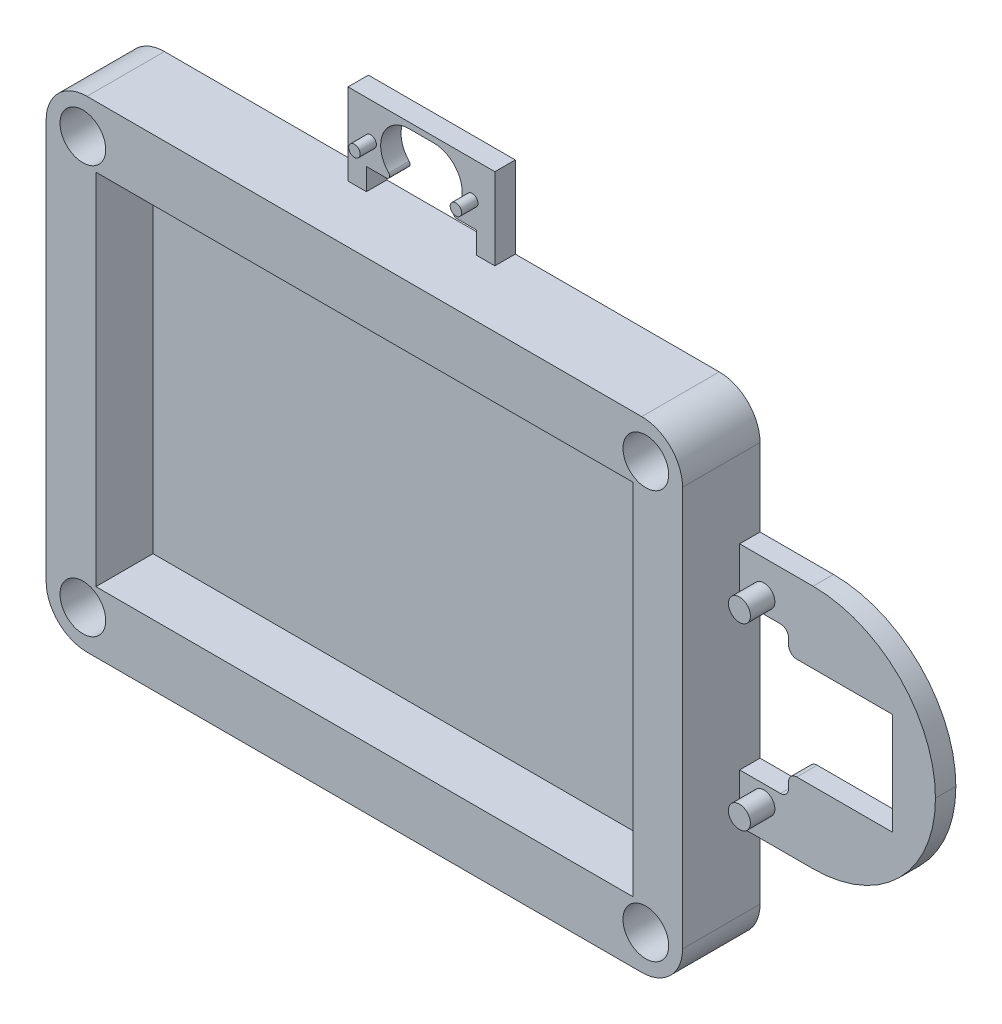
from build123d import *

# Parameters (mm, degrees)
SKETCH1_W               = 55.88
SKETCH1_H               = 83.566
BOSS_EXTRUDE1_DEPTH     = 3.175
SKETCH2_W               = 74.93
SKETCH2_H               = 102.616
SKETCH2_W_2             = 55.88
SKETCH2_H_2             = 83.566
BOSS_EXTRUDE2_DEPTH     = 12.065
CUT_EXTRUDE1_DEPTH      = 65.666075449
CUT_EXTRUDE1_DEPTH_BACK = 65.666075449
SKETCH3_R               = 3.556
CUT_EXTRUDE2_DEPTH      = 65.666075449
CUT_EXTRUDE2_DEPTH_BACK = 65.666075449
SKETCH4_W               = 1.778
SKETCH4_H               = 74.93
FILLET1_R               = 6.35
FILLET2_R               = 0.508
SKETCH5_W               = 38.1
SKETCH5_H               = 3.175
BOSS_EXTRUDE3_DEPTH     = 30.48
CUT_EXTRUDE3_DEPTH      = 89.793346738
CUT_EXTRUDE3_DEPTH_BACK = 89.793346738
SKETCH6_W               = 7.62
SKETCH6_H               = 22.86
SKETCH7_R               = 1.7145
BOSS_EXTRUDE4_DEPTH     = 3.81
CUT_EXTRUDE4_DEPTH      = 89.793346738
CUT_EXTRUDE4_DEPTH_BACK = 89.793346738
SKETCH8_W               = 22.86
SKETCH8_H               = 15.875
SKETCH9_W               = 6.6929
SKETCH9_H               = 15.875
BOSS_EXTRUDE5_DEPTH     = 3.175
FILLET3_R               = 19.05
FILLET5_R               = 1.27
SKETCH14_W              = 22.86
SKETCH14_H              = 3.175
BOSS_EXTRUDE8_DEPTH     = 12.7
CUT_EXTRUDE7_DEPTH      = 95.853357479
CUT_EXTRUDE7_DEPTH_BACK = 95.853357479
CUT_EXTRUDE8_DEPTH      = 95.853357479
CUT_EXTRUDE8_DEPTH_BACK = 95.853357479
SKETCH16_W              = 17.130818864
SKETCH16_H              = 3.4036
FILLET8_R               = 0.508
SKETCH17_R              = 0.889
BOSS_EXTRUDE9_DEPTH     = 2.54


with BuildPart() as part:
    # Sketch1 → Boss-Extrude1 (new body)
    with BuildSketch(Plane(origin=(0, 0, 0), x_dir=(0, 1, 0), z_dir=(0, 0, 1))):
        Rectangle(SKETCH1_W, SKETCH1_H)
    extrude(amount=BOSS_EXTRUDE1_DEPTH)

    # Sketch2 → Boss-Extrude2 (add)
    with BuildSketch(Plane(origin=(0, 0, 0), x_dir=(0, 1, 0), z_dir=(0, 0, 1))):
        Rectangle(SKETCH2_W, SKETCH2_H)
        Rectangle(SKETCH2_W_2, SKETCH2_H_2, mode=Mode.SUBTRACT)
    extrude(amount=BOSS_EXTRUDE2_DEPTH)

    # Sketch3 → Cut-Extrude1 (cut, two sides: drawn at the far end of the back side and taken through both)
    with BuildSketch(Plane.XY.offset(12.065).offset(-CUT_EXTRUDE1_DEPTH_BACK)):
        with Locations((-43.815, 31.75)):
            Circle(SKETCH3_R)
        with Locations((43.815, 31.75)):
            Circle(SKETCH3_R)
        with Locations((43.815, -31.75)):
            Circle(SKETCH3_R)
        with Locations((-43.815, -31.75)):
            Circle(SKETCH3_R)
    extrude(amount=CUT_EXTRUDE1_DEPTH + CUT_EXTRUDE1_DEPTH_BACK, mode=Mode.SUBTRACT)

    # Sketch4 → Cut-Extrude2 (cut, two sides: drawn at the far end of the back side and taken through both)
    with BuildSketch(Plane.XY.offset(12.065).offset(-CUT_EXTRUDE2_DEPTH_BACK)):
        with Locations((-50.419, 0)):
            Rectangle(SKETCH4_W, SKETCH4_H)
        with Locations((50.419, 0)):
            Rectangle(SKETCH4_W, SKETCH4_H)
    extrude(amount=CUT_EXTRUDE2_DEPTH + CUT_EXTRUDE2_DEPTH_BACK, mode=Mode.SUBTRACT)

    # Fillet1
    fillet1_edges = [part.edges().sort_by_distance(p)[0] for p in [
        (-49.53, -37.465, 6.0325),
        (-49.53, 37.465, 6.0325),
        (49.53, 37.465, 6.0325),
        (49.53, -37.465, 6.0325),
    ]]
    fillet(fillet1_edges, radius=FILLET1_R)

    # Fillet2
    fillet2_edges = [part.edges().sort_by_distance(p)[0] for p in [
        (-47.371, -31.75, 0),
        (40.259, -31.75, 0),
        (40.259, 31.75, 0),
        (-47.371, 31.75, 0),
    ]]
    fillet(fillet2_edges, radius=FILLET2_R)

    # Sketch5 → Boss-Extrude3 (add)
    with BuildSketch(Plane.YZ.offset(49.53)):
        with Locations((0, 1.5875)):
            Rectangle(SKETCH5_W, SKETCH5_H)
    extrude(amount=BOSS_EXTRUDE3_DEPTH)

    # Sketch6 → Cut-Extrude3 (cut, two sides: drawn at the far end of the back side and taken through both)
    with BuildSketch(Plane.XY.offset(3.175).offset(-CUT_EXTRUDE3_DEPTH_BACK)):
        with Locations((53.34, 0)):
            Rectangle(SKETCH6_W, SKETCH6_H)
    extrude(amount=CUT_EXTRUDE3_DEPTH + CUT_EXTRUDE3_DEPTH_BACK, mode=Mode.SUBTRACT)

    # Sketch7 → Boss-Extrude4 (add)
    with BuildSketch(Plane.XY.offset(3.175)):
        with Locations(Location((53.3019, 13.9573, 0), (0, 0, 180))):
            Circle(SKETCH7_R)
        with Locations(Location((53.3019, -13.9573, 0), (0, 0, 180))):
            Circle(SKETCH7_R)
    extrude(amount=BOSS_EXTRUDE4_DEPTH)

    # Sketch8 → Cut-Extrude4 (cut, two sides: drawn at the far end of the back side and taken through both)
    with BuildSketch(Plane.XY.offset(3.175).offset(-CUT_EXTRUDE4_DEPTH_BACK)):
        with Locations((68.58, 0)):
            Rectangle(SKETCH8_W, SKETCH8_H)
    extrude(amount=CUT_EXTRUDE4_DEPTH + CUT_EXTRUDE4_DEPTH_BACK, mode=Mode.SUBTRACT)

    # Sketch9 → Boss-Extrude5 (add)
    with BuildSketch(Plane.XY.offset(3.175)):
        with Locations((76.66355, 0)):
            Rectangle(SKETCH9_W, SKETCH9_H)
    extrude(amount=-BOSS_EXTRUDE5_DEPTH)

    # Fillet3
    fillet3_edges = [part.edges().sort_by_distance(p)[0] for p in [
        (80.01, -19.05, 1.5875),
        (80.01, 19.05, 1.5875),
    ]]
    fillet(fillet3_edges, radius=FILLET3_R - 0.0001)  # a hair under: the kernel refuses the full size

    # Fillet5
    fillet5_edges = [part.edges().sort_by_distance(p)[0] for p in [
        (57.15, 11.43, 1.5875),
        (57.15, -11.43, 1.5875),
        (57.15, 7.9375, 1.5875),
        (57.15, -7.9375, 1.5875),
    ]]
    fillet(fillet5_edges, radius=FILLET5_R)

    # Sketch14 → Boss-Extrude8 (add)
    with BuildSketch(Plane(origin=(0, 37.465, 0), x_dir=(-1, 0, 0), z_dir=(0, 1, 0))):
        with Locations((0, 1.5875)):
            Rectangle(SKETCH14_W, SKETCH14_H)
    extrude(amount=BOSS_EXTRUDE8_DEPTH)

    # Sketch15 → Cut-Extrude7 (cut, two sides: drawn at the far end of the back side and taken through both)
    with BuildSketch(Plane.XY.offset(3.175).offset(-CUT_EXTRUDE7_DEPTH_BACK)):
        with BuildLine():
            Line((-1.905, 49.276), (1.905, 49.276))
            ThreePointArc((1.905, 49.276), (6.35, 44.831), (1.905, 40.386))
            Line((1.905, 40.386), (-1.905, 40.386))
            ThreePointArc((-1.905, 40.386), (-6.35, 44.831), (-1.905, 49.276))
        make_face()
    extrude(amount=CUT_EXTRUDE7_DEPTH + CUT_EXTRUDE7_DEPTH_BACK, mode=Mode.SUBTRACT)

    # Sketch16 → Cut-Extrude8 (cut, two sides: drawn at the far end of the back side and taken through both)
    with BuildSketch(Plane.XY.offset(3.175).offset(-CUT_EXTRUDE8_DEPTH_BACK)):
        with Locations((0, 39.1668)):
            Rectangle(SKETCH16_W, SKETCH16_H)
    extrude(amount=CUT_EXTRUDE8_DEPTH + CUT_EXTRUDE8_DEPTH_BACK, mode=Mode.SUBTRACT)

    # Fillet8
    fillet8_edges = [part.edges().sort_by_distance(p)[0] for p in [
        (3.919301676, 40.8686, 1.5875),
        (-3.919301676, 40.8686, 1.5875),
    ]]
    fillet(fillet8_edges, radius=FILLET8_R)

    # Sketch17 → Boss-Extrude9 (add)
    with BuildSketch(Plane.XY.offset(3.175)):
        with Locations((-7.8994, 44.577)):
            Circle(SKETCH17_R)
        with Locations((7.8994, 44.577)):
            Circle(SKETCH17_R)
    extrude(amount=BOSS_EXTRUDE9_DEPTH)


solid = part.part
